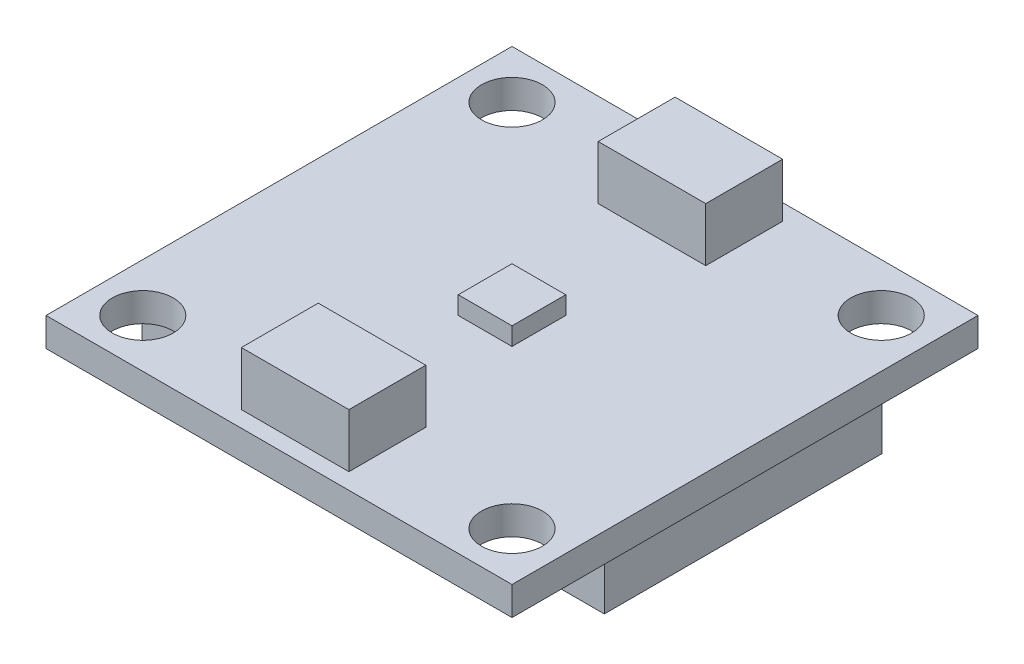
from build123d import *

# Parameters (mm, degrees)
SKETCH1_W           = 26
SKETCH1_H           = 26
SKETCH1_R           = 1.7
BOSS_EXTRUDE1_DEPTH = 1.6
SKETCH2_W           = 6
SKETCH2_H           = 4.29
BOSS_EXTRUDE2_DEPTH = 3
SKETCH3_W           = 2.5
SKETCH3_H           = 15.5
BOSS_EXTRUDE3_DEPTH = 2.5
SKETCH4_W           = 3
SKETCH4_H           = 3
BOSS_EXTRUDE4_DEPTH = 1


with BuildPart() as part:
    # Sketch1 → Boss-Extrude1 (new body)
    with BuildSketch(Plane(origin=(0, 0, 0), x_dir=(1, 0, 0), z_dir=(0, 1, 0))):
        Rectangle(SKETCH1_W, SKETCH1_H)
        with Locations((-10.3, 10.3)):
            Circle(SKETCH1_R, mode=Mode.SUBTRACT)
        with Locations((10.3, 10.3)):
            Circle(SKETCH1_R, mode=Mode.SUBTRACT)
        with Locations((-10.3, -10.3)):
            Circle(SKETCH1_R, mode=Mode.SUBTRACT)
        with Locations((10.3, -10.3)):
            Circle(SKETCH1_R, mode=Mode.SUBTRACT)
    extrude(amount=BOSS_EXTRUDE1_DEPTH)

    # Sketch2 → Boss-Extrude2 (add)
    with BuildSketch(Plane(origin=(0, 1.6, 0), x_dir=(1, 0, 0), z_dir=(0, 1, 0))):
        with Locations((0, 9.955)):
            Rectangle(SKETCH2_W, SKETCH2_H)
        with Locations((0, -9.955)):
            Rectangle(SKETCH2_W, SKETCH2_H)
    extrude(amount=BOSS_EXTRUDE2_DEPTH)

    # Sketch3 → Boss-Extrude3 (add)
    with BuildSketch(Plane.XZ):
        with Locations((-11.65, 0)):
            Rectangle(SKETCH3_W, SKETCH3_H)
        with Locations((11.65, 0)):
            Rectangle(SKETCH3_W, SKETCH3_H)
    extrude(amount=BOSS_EXTRUDE3_DEPTH)

    # Sketch4 → Boss-Extrude4 (add)
    with BuildSketch(Plane(origin=(0, 1.6, 0), x_dir=(1, 0, 0), z_dir=(0, 1, 0))):
        Rectangle(SKETCH4_W, SKETCH4_H)
    extrude(amount=BOSS_EXTRUDE4_DEPTH)


solid = part.part
